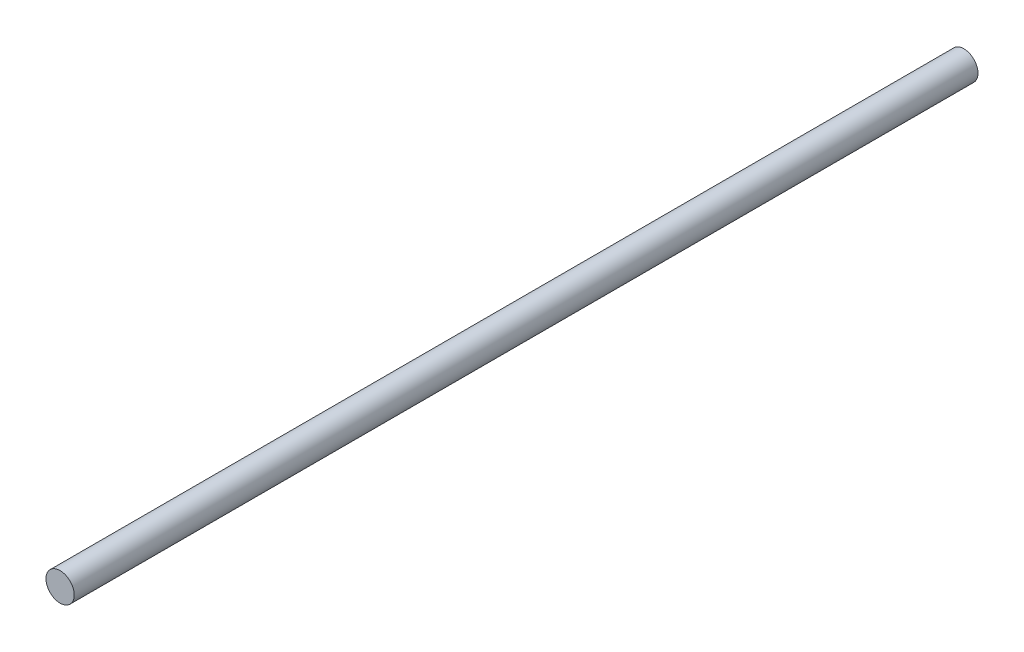
from build123d import *

# Parameters (mm, degrees)
SKETCH1_R           = 6.35
BOSS_EXTRUDE1_DEPTH = 406.4


with BuildPart() as part:
    # Sketch1 → Boss-Extrude1 (new body)
    with BuildSketch(Plane.XY):
        Circle(SKETCH1_R)
    extrude(amount=BOSS_EXTRUDE1_DEPTH)


solid = part.part
